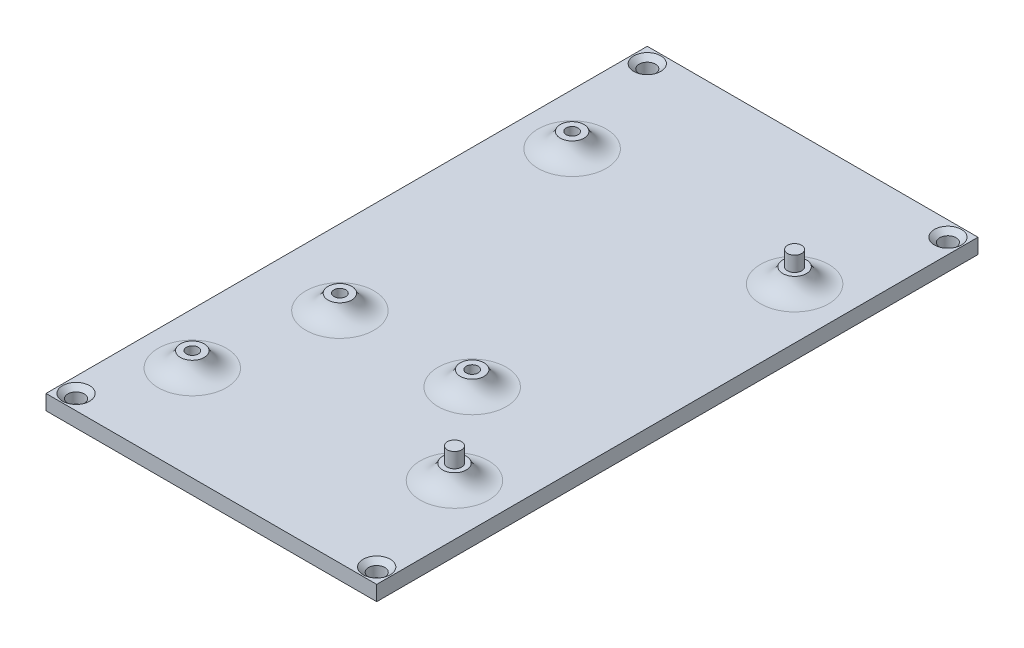
from build123d import *

# Parameters (mm, degrees)
SKETCH1_W                                         = 69.85
SKETCH1_H                                         = 127
BOSS_EXTRUDE1_DEPTH                               = 3.175
SKETCH2_R                                         = 2.5
BOSS_EXTRUDE2_DEPTH                               = 3.175
M3X0_5_TAPPED_HOLE1_D                             = 2.5
SKETCH5_R                                         = 1.5
BOSS_EXTRUDE3_DEPTH                               = 3.175
CSK_FOR_4_FLAT_HEAD_MACHINE_SCREW_100_D           = 3.4544
CSK_FOR_4_FLAT_HEAD_MACHINE_SCREW_100_CSINK_D     = 5.715
CSK_FOR_4_FLAT_HEAD_MACHINE_SCREW_100_CSINK_ANGLE = 100
FILLET1_R                                         = 5.08


with BuildPart() as part:
    # Sketch1 → Boss-Extrude1 (new body)
    with BuildSketch(Plane(origin=(0, 0, 0), x_dir=(1, 0, 0), z_dir=(0, 1, 0))):
        with Locations((34.925, 63.5)):
            Rectangle(SKETCH1_W, SKETCH1_H)
    extrude(amount=BOSS_EXTRUDE1_DEPTH)

    # Sketch2 → Boss-Extrude2 (add)
    with BuildSketch(Plane(origin=(0, 3.175, 0), x_dir=(1, 0, 0), z_dir=(0, 1, 0))):
        with Locations(Location((10.795, 100.33, 0), (0, 0, 90))):
            Circle(SKETCH2_R)
        with Locations(Location((59.055, 99.06, 0), (0, 0, 90))):
            Circle(SKETCH2_R)
        with Locations(Location((15.875, 46.19857895, 0), (0, 0, 90))):
            Circle(SKETCH2_R)
        with Locations(Location((43.815, 46.19857895, 0), (0, 0, 90))):
            Circle(SKETCH2_R)
        with Locations(Location((10.795, 20.102862456, 0), (0, 0, 90))):
            Circle(SKETCH2_R)
        with Locations(Location((59.055, 27.216985797, 0), (0, 0, 90))):
            Circle(SKETCH2_R)
    extrude(amount=BOSS_EXTRUDE2_DEPTH)

    # M3x0.5 Tapped Hole1 (through all)
    with Locations(Plane(origin=(0, 6.35, 0), x_dir=(1, 0, 0), z_dir=(0, 1, 0))):
        with Locations((10.795, 100.33), (15.875, 46.19857895), (43.815, 46.19857895), (10.795, 20.102862456)):
            Hole(M3X0_5_TAPPED_HOLE1_D / 2)

    # Sketch5 → Boss-Extrude3 (add)
    with BuildSketch(Plane(origin=(0, 6.35, 0), x_dir=(1, 0, 0), z_dir=(0, 1, 0))):
        with Locations(Location((59.055, 99.06, 0), (0, 0, 270))):
            Circle(SKETCH5_R)
        with Locations(Location((59.055, 27.216985797, 0), (0, 0, 270))):
            Circle(SKETCH5_R)
    extrude(amount=BOSS_EXTRUDE3_DEPTH)

    # CSK for #4 Flat Head Machine Screw (100)1 (through all)
    with Locations(Plane(origin=(0, 3.175, 0), x_dir=(1, 0, 0), z_dir=(0, 1, 0))):
        with Locations((3.175, 123.825), (66.675, 123.825), (66.675, 3.175), (3.175, 3.175)):
            CounterSinkHole(CSK_FOR_4_FLAT_HEAD_MACHINE_SCREW_100_D / 2, CSK_FOR_4_FLAT_HEAD_MACHINE_SCREW_100_CSINK_D / 2, counter_sink_angle=CSK_FOR_4_FLAT_HEAD_MACHINE_SCREW_100_CSINK_ANGLE)

    # Fillet1
    # the kernel refuses this fillet: 5.08 mm, written as the material it adds along each edge
    with BuildSketch(Plane(origin=(10.795, 3.175, -100.33), x_dir=(0, 0, -1), z_dir=(1, 0, 0))) as fillet1_piece_1:
        with BuildLine():
            CenterArc((7.209286039, 5.08), FILLET1_R, 202.024312837, 67.975687163)
            Line((2.5, 3.175), (2.405814279, 3.1369))
            ThreePointArc((2.405814279, 3.1369), (2.3984, 1.5875), (2.3984, 0))
            Line((2.3984, 0), (2.5, -0.1016))
            Line((2.5, -0.1016), (7.209286039, -0.1016))
            Line((7.209286039, -0.1016), (7.209286039, 0))
        make_face()
    revolve(axis=Axis((10.795, 3.175, -100.33), (0, 1, 0)))
    with BuildSketch(Plane(origin=(59.055, 3.175, -99.06), x_dir=(0, 0, -1), z_dir=(1, 0, 0))) as fillet1_piece_2:
        with BuildLine():
            CenterArc((7.209286039, 5.08), FILLET1_R, 202.024312837, 67.975687163)
            Line((2.5, 3.175), (2.405814279, 3.1369))
            ThreePointArc((2.405814279, 3.1369), (2.3984, 1.5875), (2.3984, 0))
            Line((2.3984, 0), (2.5, -0.1016))
            Line((2.5, -0.1016), (7.209286039, -0.1016))
            Line((7.209286039, -0.1016), (7.209286039, 0))
        make_face()
    revolve(axis=Axis((59.055, 3.175, -99.06), (0, 1, 0)))
    with BuildSketch(Plane(origin=(15.875, 3.175, -46.19857895), x_dir=(0, 0, -1), z_dir=(1, 0, 0))) as fillet1_piece_3:
        with BuildLine():
            CenterArc((7.209286039, 5.08), FILLET1_R, 202.024312837, 67.975687163)
            Line((2.5, 3.175), (2.405814279, 3.1369))
            ThreePointArc((2.405814279, 3.1369), (2.3984, 1.5875), (2.3984, 0))
            Line((2.3984, 0), (2.5, -0.1016))
            Line((2.5, -0.1016), (7.209286039, -0.1016))
            Line((7.209286039, -0.1016), (7.209286039, 0))
        make_face()
    revolve(axis=Axis((15.875, 3.175, -46.19857895), (0, 1, 0)))
    with BuildSketch(Plane(origin=(43.815, 3.175, -46.19857895), x_dir=(0, 0, -1), z_dir=(1, 0, 0))) as fillet1_piece_4:
        with BuildLine():
            CenterArc((7.209286039, 5.08), FILLET1_R, 202.024312837, 67.975687163)
            Line((2.5, 3.175), (2.405814279, 3.1369))
            ThreePointArc((2.405814279, 3.1369), (2.3984, 1.5875), (2.3984, 0))
            Line((2.3984, 0), (2.5, -0.1016))
            Line((2.5, -0.1016), (7.209286039, -0.1016))
            Line((7.209286039, -0.1016), (7.209286039, 0))
        make_face()
    revolve(axis=Axis((43.815, 3.175, -46.19857895), (0, 1, 0)))
    with BuildSketch(Plane(origin=(10.795, 3.175, -20.102862456), x_dir=(0, 0, -1), z_dir=(1, 0, 0))) as fillet1_piece_5:
        with BuildLine():
            CenterArc((7.209286039, 5.08), FILLET1_R, 202.024312837, 67.975687163)
            Line((2.5, 3.175), (2.405814279, 3.1369))
            ThreePointArc((2.405814279, 3.1369), (2.3984, 1.5875), (2.3984, 0))
            Line((2.3984, 0), (2.5, -0.1016))
            Line((2.5, -0.1016), (7.209286039, -0.1016))
            Line((7.209286039, -0.1016), (7.209286039, 0))
        make_face()
    revolve(axis=Axis((10.795, 3.175, -20.102862456), (0, 1, 0)))
    with BuildSketch(Plane(origin=(59.055, 3.175, -27.216985797), x_dir=(0, 0, -1), z_dir=(1, 0, 0))) as fillet1_piece_6:
        with BuildLine():
            CenterArc((7.209286039, 5.08), FILLET1_R, 202.024312837, 67.975687163)
            Line((2.5, 3.175), (2.405814279, 3.1369))
            ThreePointArc((2.405814279, 3.1369), (2.3984, 1.5875), (2.3984, 0))
            Line((2.3984, 0), (2.5, -0.1016))
            Line((2.5, -0.1016), (7.209286039, -0.1016))
            Line((7.209286039, -0.1016), (7.209286039, 0))
        make_face()
    revolve(axis=Axis((59.055, 3.175, -27.216985797), (0, 1, 0)))


solid = part.part
